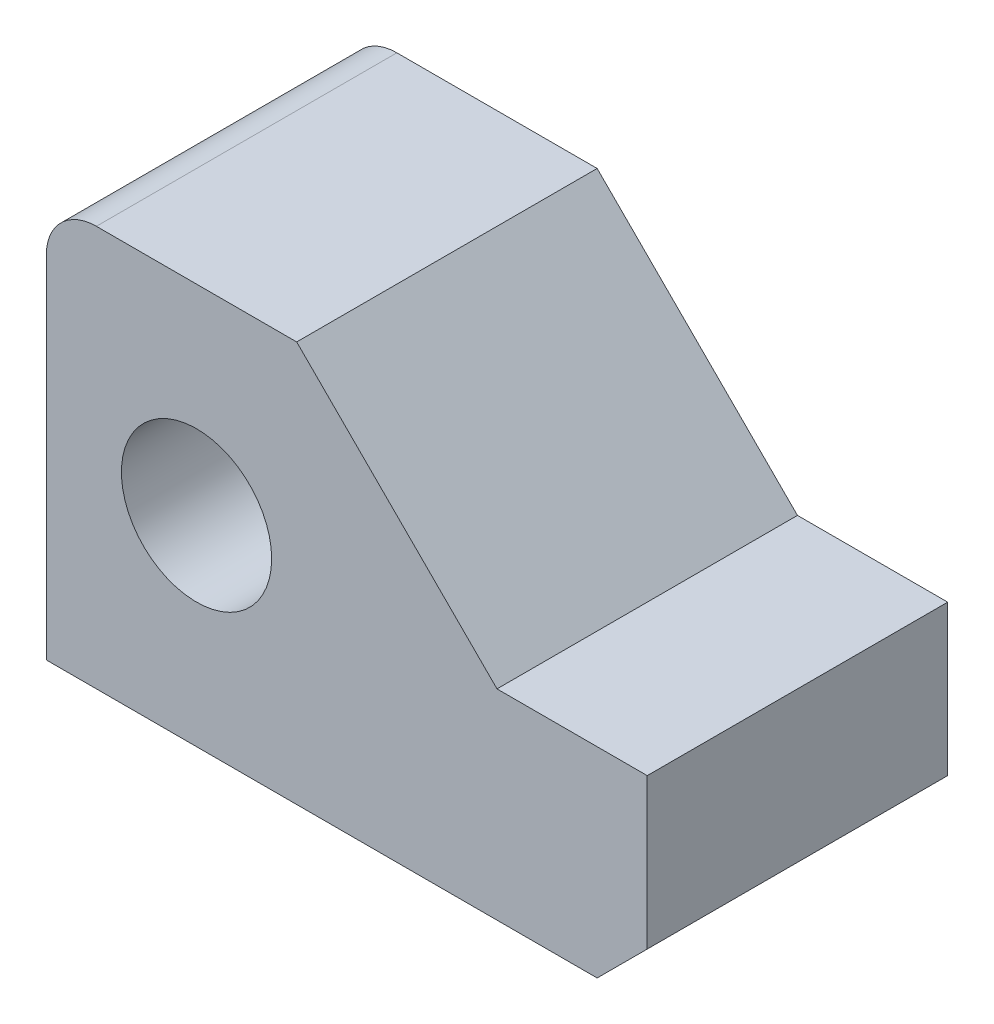
from build123d import *

# Parameters (mm, degrees)
BOSS_EXTRUDE1_DEPTH      = 15
BOSS_EXTRUDE1_DEPTH_BACK = 15
SKETCH1_R                = 7.5


with BuildPart() as part:
    # Sketch1 → Boss-Extrude1 (new, two sides: drawn at the far end of the back side and taken through both)
    with BuildSketch(Plane.XY.offset(-BOSS_EXTRUDE1_DEPTH_BACK)):
        with BuildLine():
            Line((0, 0), (55, 0))
            Line((55, 0), (60, 5))
            Line((60, 5), (60, 20))
            Line((60, 20), (45, 20))
            Line((45, 20), (25, 40))
            Line((25, 40), (5, 40))
            ThreePointArc((5, 40), (1.464466094, 38.535533906), (0, 35))
            Line((0, 35), (0, 0))
        make_face()
        with Locations((15, 20)):
            Circle(SKETCH1_R, mode=Mode.SUBTRACT)
    extrude(amount=BOSS_EXTRUDE1_DEPTH + BOSS_EXTRUDE1_DEPTH_BACK)


solid = part.part
